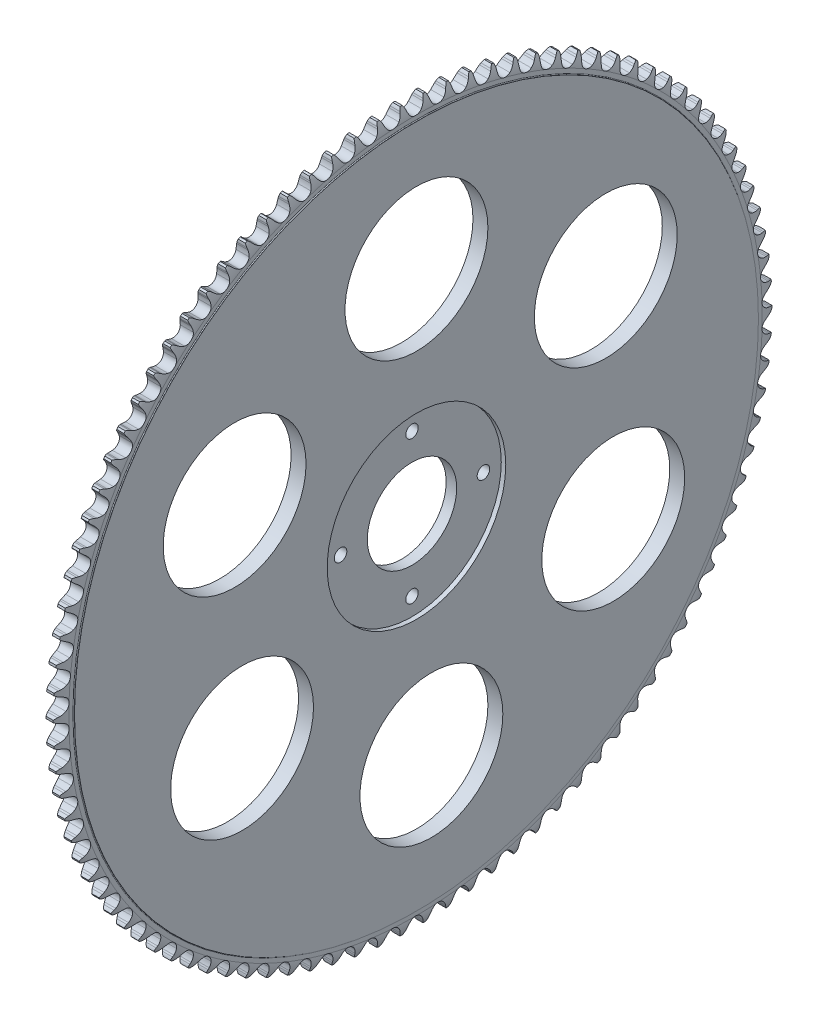
from build123d import *

# Parameters (mm, degrees)
CUT_EXTRUDE_1_DEPTH      = 8.358656443
PATTERN_CIRCULAR_1_COUNT = 98
SKETCH_5_R               = 80
CUT_EXTRUDE_3_DEPTH      = 570.346099415
SKETCH_6_R               = 100
CUT_EXTRUDE_4_DEPTH      = 5
HOLE_WIZARD_M16_1_D      = 14


with BuildPart() as part:
    # 草图1 → 旋转1 (revolve)
    with BuildSketch(Plane.XY, mode=Mode.PRIVATE) as revolve_1_sk:
        with BuildLine():
            Line((-8.358656443, 50), (-8.358656443, 383))
            Line((-8.358656443, 383), (-8.151675154, 383))
            ThreePointArc((-8.151675154, 383), (-7.566243663, 383.242493663), (-7.32375, 383.827925154))
            Line((-7.32375, 383.827925154), (-7.32375, 388.296346608))
            ThreePointArc((-7.32375, 388.296346608), (-6.713969662, 395.640231261), (-4.02175, 402.5))
            Line((-4.02175, 402.5), (4.02175, 402.5))
            ThreePointArc((4.02175, 402.5), (6.713969662, 395.640231261), (7.32375, 388.296346608))
            Line((7.32375, 388.296346608), (7.32375, 383.827925154))
            ThreePointArc((7.32375, 383.827925154), (7.566243663, 383.242493663), (8.151675154, 383))
            Line((8.151675154, 383), (8.358656443, 383))
            Line((8.358656443, 383), (8.358656443, 50))
            Line((8.358656443, 50), (-8.358656443, 50))
        make_face()
    revolve(revolve_1_sk.sketch.rotate(Axis((-12.7, 0, 0), (1, 0, 0)), 90), axis=Axis((-12.7, 0, 0), (1, 0, 0)))

    # 草图2 → 切除-拉伸1 (cut, symmetric)
    with BuildSketch(Plane(origin=(0, 0, 0), x_dir=(0, 0, -1), z_dir=(1, 0, 0))):
        with BuildLine():
            Line((9.370228675, 397.163598532), (9.995997057, 399.068713329))
            ThreePointArc((9.995997057, 399.068713329), (10.715141052, 400.769939312), (11.70417841, 402.329792841))
            ThreePointArc((11.70417841, 402.329792841), (0, 402.5), (-11.70417841, 402.329792841))
            ThreePointArc((-11.70417841, 402.329792841), (-10.715141052, 400.769939312), (-9.995997057, 399.068713329))
            Line((-9.995997057, 399.068713329), (-9.370228675, 397.163598532))
            ThreePointArc((-9.370228675, 397.163598532), (-8.1625452, 394.253857314), (-6.527956075, 391.560678573))
            ThreePointArc((-6.527956075, 391.560678573), (0, 388.206646608), (6.527956075, 391.560678573))
            ThreePointArc((6.527956075, 391.560678573), (8.1625452, 394.253857314), (9.370228675, 397.163598532))
        make_face()
    cut_extrude_1 = extrude(amount=CUT_EXTRUDE_1_DEPTH, both=True, mode=Mode.SUBTRACT)

    # 阵列(圆周)1: 切除-拉伸1 ×98 about axis
    pattern_circular_1_axis = Axis((0, 0, 0), (1, 0, 0))
    for i in range(1, PATTERN_CIRCULAR_1_COUNT):
        add(cut_extrude_1.rotate(pattern_circular_1_axis, i * 360 / PATTERN_CIRCULAR_1_COUNT), mode=Mode.SUBTRACT)

    # 草图5 → 切除-拉伸3 (cut, through all)
    with BuildSketch(Plane(origin=(8.358656443, 0, 0), x_dir=(0, 0, -1), z_dir=(1, 0, 0))):
        with Locations((0, 240)):
            Circle(SKETCH_5_R)
        with Locations((212.02542513, 127.238808821)):
            Circle(SKETCH_5_R)
        with Locations((220.384081573, -112.761191179)):
            Circle(SKETCH_5_R)
        with Locations((16.717312886, -240)):
            Circle(SKETCH_5_R)
        with Locations((-195.308112244, -127.238808821)):
            Circle(SKETCH_5_R)
        with Locations((-203.666768687, 112.761191179)):
            Circle(SKETCH_5_R)
    extrude(amount=-CUT_EXTRUDE_3_DEPTH, mode=Mode.SUBTRACT)

    # 草图6 → 切除-拉伸4 (cut)
    with BuildSketch(Plane(origin=(8.358656443, 0, 0), x_dir=(0, 0, -1), z_dir=(1, 0, 0))):
        Circle(SKETCH_6_R)
    extrude(amount=-CUT_EXTRUDE_4_DEPTH, mode=Mode.SUBTRACT)

    # M16 螺纹孔1 (through all)
    with Locations(Plane(origin=(3.358656443, 0, 0), x_dir=(0, 0, -1), z_dir=(1, 0, 0))):
        with Locations((0, 80), (-80, 0), (0, -80), (80, 0)):
            Hole(HOLE_WIZARD_M16_1_D / 2)


solid = part.part
